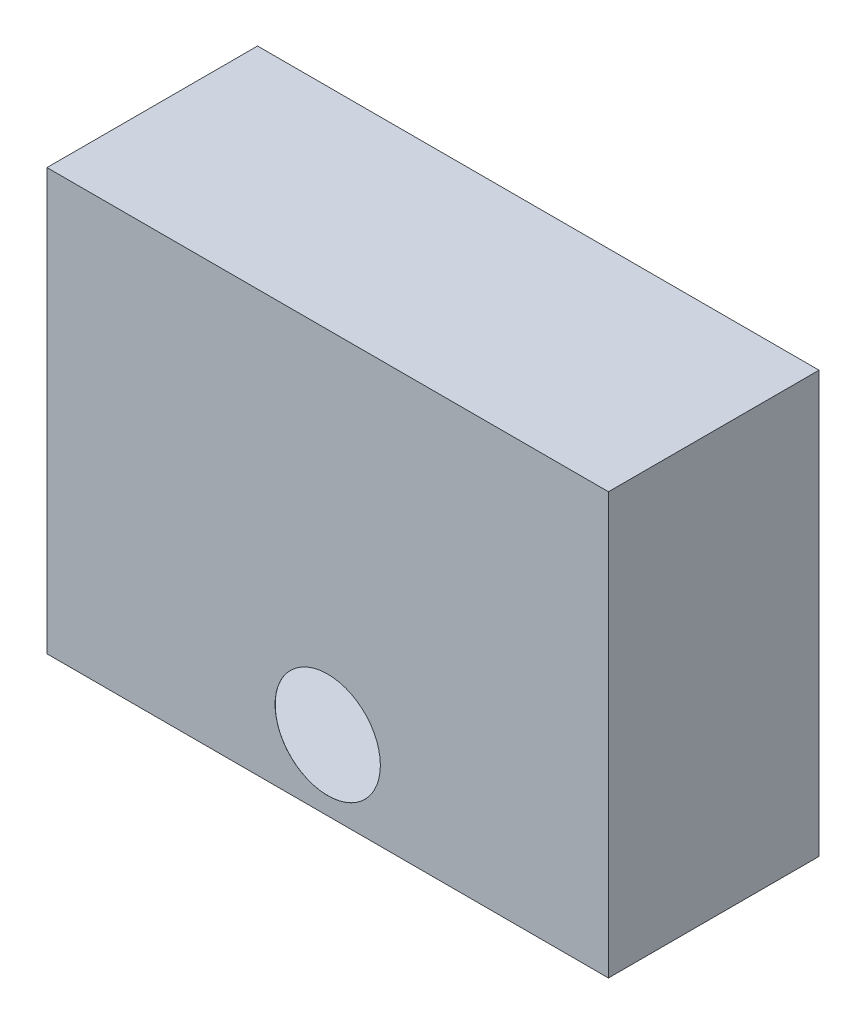
from build123d import *

# Parameters (mm, degrees)
SKETCH1_W           = 80
SKETCH1_H           = 60
BOSS_EXTRUDE1_DEPTH = 30
SHELL1_START        = -39
SHELL1_OUTLINE_W    = 58
SHELL1_OUTLINE_H    = 28.99
SHELL1_DEPTH        = 78
CUT_EXTRUDE4_REACH  = 60.31
SKETCH2_R           = 7.5


# Read off the part's stored shape, not the designer's step: Shell1
with BuildPart() as part:
    # Sketch1 → Boss-Extrude1 (new body)
    with BuildSketch(Plane.XY):
        Rectangle(SKETCH1_W, SKETCH1_H)
    extrude(amount=BOSS_EXTRUDE1_DEPTH)

    # Shell1 outline → Shell1 (cut)
    with BuildSketch(Plane.YZ.offset(SHELL1_START)):
        with Locations((0, 15.495)):
            Rectangle(SHELL1_OUTLINE_W, SHELL1_OUTLINE_H)
    extrude(amount=SHELL1_DEPTH, mode=Mode.SUBTRACT)

    # Sketch2 → Cut-Extrude4 (cut, up to next)
    with BuildSketch(Plane.XY.offset(30), mode=Mode.PRIVATE) as cut_extrude4_sk1:
        with Locations((0, -20)):
            Circle(SKETCH2_R)
    cut_extrude4_tool1 = extrude(cut_extrude4_sk1.sketch, amount=-CUT_EXTRUDE4_REACH, mode=Mode.PRIVATE) & part.part
    add(cut_extrude4_tool1.solids().sort_by_distance((0, -20, 30))[0], mode=Mode.SUBTRACT)


solid = part.part
